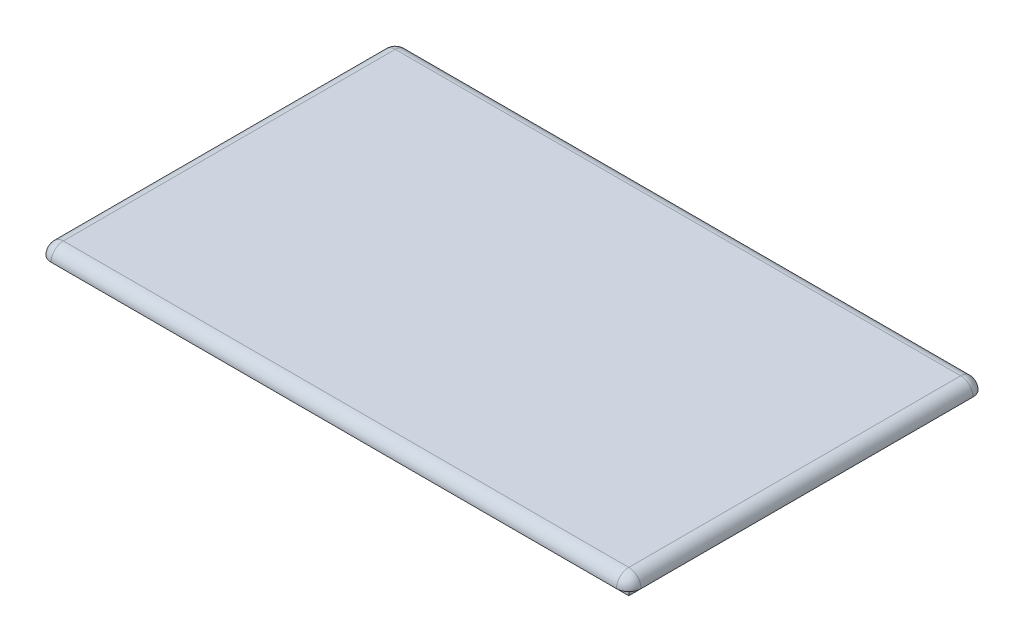
from build123d import *

# Parameters (mm, degrees)
SKETCH_1_W      = 46
SKETCH_1_H      = 27
EXTRUDE_1_DEPTH = 1
SKETCH_2_W      = 48
SKETCH_2_H      = 29
EXTRUDE_2_DEPTH = 1
FILLET_1_R      = 1


with BuildPart() as part:
    # ｽｹｯﾁ1 → ﾎﾞｽ - 押し出し1 (new body)
    with BuildSketch(Plane(origin=(0, 0, 0), x_dir=(1, 0, 0), z_dir=(0, 1, 0))):
        with Locations((-24.456990453, 23.251505547)):
            Rectangle(SKETCH_1_W, SKETCH_1_H)
    extrude(amount=EXTRUDE_1_DEPTH)

    # ｽｹｯﾁ2 → ﾎﾞｽ - 押し出し2 (add)
    with BuildSketch(Plane(origin=(0, 1, 0), x_dir=(1, 0, 0), z_dir=(0, 1, 0))):
        with Locations((-24.456990453, 23.251505547)):
            Rectangle(SKETCH_2_W, SKETCH_2_H)
    extrude(amount=EXTRUDE_2_DEPTH)

    # ﾌｨﾚｯﾄ1
    fillet_1_edges = [part.edges().sort_by_distance(p)[0] for p in [
        (-48.456990453, 1.5, -37.751505547),
        (-48.456990453, 1.5, -8.751505547),
        (-0.456990453, 1.5, -8.751505547),
        (-0.456990453, 1.5, -37.751505547),
        (-48.456990453, 2, -23.251505547),
        (-24.456990453, 2, -8.751505547),
        (-0.456990453, 2, -23.251505547),
        (-24.456990453, 2, -37.751505547),
    ]]
    fillet(fillet_1_edges, radius=FILLET_1_R - 0.0001)  # a hair under: the kernel refuses the full size


solid = part.part
